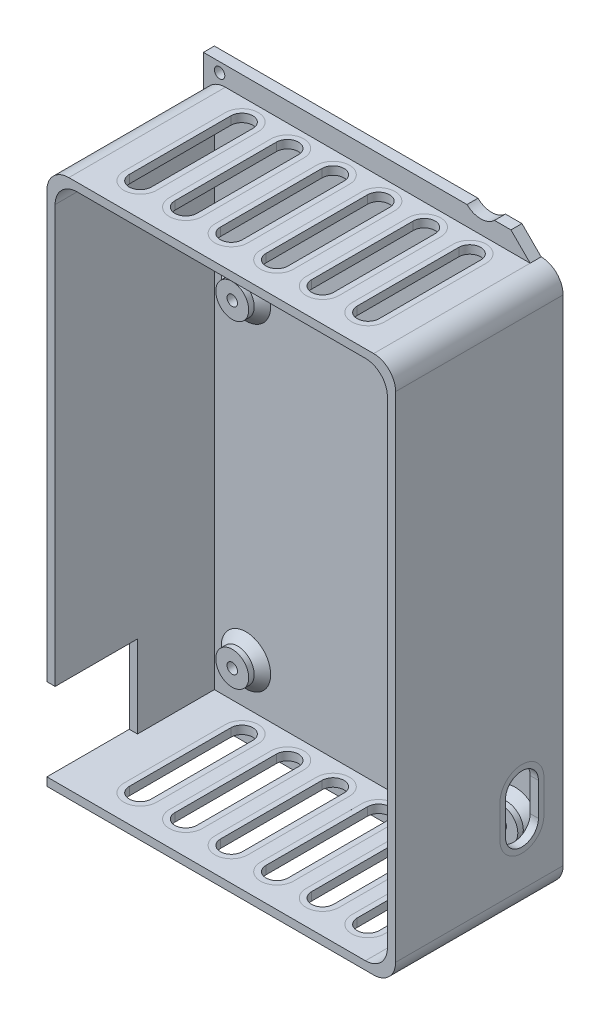
from build123d import *

# Parameters (mm, degrees)
SKETCH1_W            = 98
SKETCH1_H            = 63.5
SKETCH1_R            = 0.95
BOSS_EXTRUDE1_DEPTH  = 1.5
BOSS_EXTRUDE7_START  = 1.5
SKETCH1_9_R          = 3
SKETCH1_9_R_2        = 0.95
BOSS_EXTRUDE7_DEPTH  = 2.5
SKETCH1_15_R         = 2.1
SKETCH1_15_R_2       = 0.95
CUT_EXTRUDE3_DEPTH   = 2.2
CHAMFER1_SIZE        = 1.5
BOSS_EXTRUDE6_START  = 1.5
SKETCH1_8_W          = 98
SKETCH1_8_H          = 63.5
SKETCH1_8_W_2        = 95
SKETCH1_8_H_2        = 60.5
BOSS_EXTRUDE6_DEPTH  = 29
SKETCH3_W            = 15
SKETCH3_H            = 15
CUT_EXTRUDE2_DEPTH   = 1.5
FILLET1_R            = 4
BOSS_EXTRUDE11_START = -2
SKETCH6_R            = 0.95
BOSS_EXTRUDE11_DEPTH = 2
CUT_EXTRUDE4_DEPTH   = 1.5
BOSS_EXTRUDE10_DEPTH = 1.5
CUT_EXTRUDE7_DEPTH   = 1.5
CUT_EXTRUDE8_START   = -96.5
CUT_EXTRUDE8_DEPTH   = 1.5
BOSS_EXTRUDE8_DEPTH  = 1.5
BOSS_EXTRUDE9_START  = -96.5
BOSS_EXTRUDE9_DEPTH  = 1.5
LPATTERN1_START      = -49
LPATTERN1_DEPTH      = 1.5
LPATTERN1_2_DEPTH    = 1.5
LPATTERN1_3_DEPTH    = 1.5
LPATTERN1_4_DEPTH    = 1.5
LPATTERN1_5_DEPTH    = 1.5
LPATTERN1_START_2    = 47.5
LPATTERN1_6_DEPTH    = 1.5
LPATTERN1_7_DEPTH    = 1.5
LPATTERN1_8_DEPTH    = 1.5
LPATTERN1_9_DEPTH    = 1.5
LPATTERN1_10_DEPTH   = 1.5


with BuildPart() as part:
    # Sketch1 → Boss-Extrude1 (new body)
    with BuildSketch(Plane(origin=(0, 0, 0), x_dir=(0, 1, 0), z_dir=(0, 0, 1))):
        Rectangle(SKETCH1_W, SKETCH1_H)
        with Locations(Location((-40, 24.5, 0), (0, 0, 270))):
            Circle(SKETCH1_R, mode=Mode.SUBTRACT)
        with Locations(Location((-40, -24.5, 0), (0, 0, 270))):
            Circle(SKETCH1_R, mode=Mode.SUBTRACT)
        with Locations(Location((18, 24.5, 0), (0, 0, 270))):
            Circle(SKETCH1_R, mode=Mode.SUBTRACT)
        with Locations(Location((18, -24.5, 0), (0, 0, 270))):
            Circle(SKETCH1_R, mode=Mode.SUBTRACT)
    extrude(amount=BOSS_EXTRUDE1_DEPTH)

    # Sketch1<9> → Boss-Extrude7 (add)
    # profile 1 of 4: a face of its own
    with BuildSketch(Plane(origin=(0, 0, 0), x_dir=(0, 1, 0), z_dir=(0, 0, 1)).offset(BOSS_EXTRUDE7_START)):
        with Locations(Location((-40, 24.5, 0), (0, 0, 270))):
            Circle(SKETCH1_9_R)
        with Locations(Location((-40, 24.5, 0), (0, 0, 270))):
            Circle(SKETCH1_9_R_2, mode=Mode.SUBTRACT)
    # profile 2 of 4: a face of its own
    with BuildSketch(Plane(origin=(0, 0, 0), x_dir=(0, 1, 0), z_dir=(0, 0, 1)).offset(BOSS_EXTRUDE7_START)):
        with Locations(Location((-40, -24.5, 0), (0, 0, 270))):
            Circle(SKETCH1_9_R)
        with Locations(Location((-40, -24.5, 0), (0, 0, 270))):
            Circle(SKETCH1_9_R_2, mode=Mode.SUBTRACT)
    # profile 3 of 4: a face of its own
    with BuildSketch(Plane(origin=(0, 0, 0), x_dir=(0, 1, 0), z_dir=(0, 0, 1)).offset(BOSS_EXTRUDE7_START)):
        with Locations(Location((18, 24.5, 0), (0, 0, 270))):
            Circle(SKETCH1_9_R)
        with Locations(Location((18, 24.5, 0), (0, 0, 270))):
            Circle(SKETCH1_9_R_2, mode=Mode.SUBTRACT)
    # profile 4 of 4: a face of its own
    with BuildSketch(Plane(origin=(0, 0, 0), x_dir=(0, 1, 0), z_dir=(0, 0, 1)).offset(BOSS_EXTRUDE7_START)):
        with Locations(Location((18, -24.5, 0), (0, 0, 270))):
            Circle(SKETCH1_9_R)
        with Locations(Location((18, -24.5, 0), (0, 0, 270))):
            Circle(SKETCH1_9_R_2, mode=Mode.SUBTRACT)
    extrude(amount=BOSS_EXTRUDE7_DEPTH)

    # Sketch1<15> → Cut-Extrude3 (cut)
    # profile 1 of 4: a face of its own
    with BuildSketch(Plane(origin=(0, 0, 0), x_dir=(0, 1, 0), z_dir=(0, 0, 1))):
        with Locations(Location((18, -24.5, 0), (0, 0, 270))):
            Circle(SKETCH1_15_R)
        with Locations(Location((18, -24.5, 0), (0, 0, 270))):
            Circle(SKETCH1_15_R_2, mode=Mode.SUBTRACT)
    # profile 2 of 4: a face of its own
    with BuildSketch(Plane(origin=(0, 0, 0), x_dir=(0, 1, 0), z_dir=(0, 0, 1))):
        with Locations(Location((18, 24.5, 0), (0, 0, 270))):
            Circle(SKETCH1_15_R)
        with Locations(Location((18, 24.5, 0), (0, 0, 270))):
            Circle(SKETCH1_15_R_2, mode=Mode.SUBTRACT)
    # profile 3 of 4: a face of its own
    with BuildSketch(Plane(origin=(0, 0, 0), x_dir=(0, 1, 0), z_dir=(0, 0, 1))):
        with Locations(Location((-40, 24.5, 0), (0, 0, 270))):
            Circle(SKETCH1_15_R)
        with Locations(Location((-40, 24.5, 0), (0, 0, 270))):
            Circle(SKETCH1_15_R_2, mode=Mode.SUBTRACT)
    # profile 4 of 4: a face of its own
    with BuildSketch(Plane(origin=(0, 0, 0), x_dir=(0, 1, 0), z_dir=(0, 0, 1))):
        with Locations(Location((-40, -24.5, 0), (0, 0, 270))):
            Circle(SKETCH1_15_R)
        with Locations(Location((-40, -24.5, 0), (0, 0, 270))):
            Circle(SKETCH1_15_R_2, mode=Mode.SUBTRACT)
    extrude(amount=CUT_EXTRUDE3_DEPTH, mode=Mode.SUBTRACT)

    # Chamfer1
    chamfer1_edges = [part.edges().sort_by_distance(p)[0] for p in [
        (21.5, 18, 1.5),
        (-27.5, 18, 1.5),
        (-27.5, -40, 1.5),
        (21.5, -40, 1.5),
    ]]
    chamfer(chamfer1_edges, length=CHAMFER1_SIZE)

    # Sketch1<8> → Boss-Extrude6 (add)
    with BuildSketch(Plane(origin=(0, 0, 0), x_dir=(0, 1, 0), z_dir=(0, 0, 1)).offset(BOSS_EXTRUDE6_START)):
        Rectangle(SKETCH1_8_W, SKETCH1_8_H)
        Rectangle(SKETCH1_8_W_2, SKETCH1_8_H_2, mode=Mode.SUBTRACT)
    extrude(amount=BOSS_EXTRUDE6_DEPTH)

    # Sketch3 → Cut-Extrude2 (cut)
    with BuildSketch(Plane.YZ.offset(-30.25)):
        with Locations((-40, 23)):
            Rectangle(SKETCH3_W, SKETCH3_H)
    extrude(amount=-CUT_EXTRUDE2_DEPTH, mode=Mode.SUBTRACT)

    # Fillet1
    fillet1_edges = [part.edges().sort_by_distance(p)[0] for p in [
        (-30.25, 47.5, 16),
        (30.25, -47.5, 16),
        (30.25, 47.5, 16),
        (31.75, -49, 15.25),
        (-31.75, 49, 15.25),
        (31.75, 49, 15.25),
    ]]
    fillet(fillet1_edges, radius=FILLET1_R)

    # Sketch6 → Boss-Extrude11 (add)
    # profile 1 of 2: a face of its own
    with BuildSketch(Plane(origin=(0, 0, 0), x_dir=(1, 0, 0), z_dir=(0, 0, -1)).offset(BOSS_EXTRUDE11_START)):
        with BuildLine():
            Line((-31.75, 49), (27.75, 49))
            Line((27.75, 49), (24.25, 52.5))
            Line((24.25, 52.5), (21.25, 52.5))
            ThreePointArc((21.25, 52.5), (18.75, 51.5), (16.25, 52.5))
            Line((16.25, 52.5), (-31.75, 52.5))
            Line((-31.75, 52.5), (-31.75, 49))
        make_face()
        with Locations(Location((-28.8, 50.75, 0), (0, 0, 180))):
            Circle(SKETCH6_R, mode=Mode.SUBTRACT)
    # profile 2 of 2: a face of its own
    with BuildSketch(Plane(origin=(0, 0, 0), x_dir=(1, 0, 0), z_dir=(0, 0, -1)).offset(BOSS_EXTRUDE11_START)):
        with BuildLine():
            Line((-31.75, -45), (-31.75, -52.5))
            Line((-31.75, -52.5), (16.25, -52.5))
            ThreePointArc((16.25, -52.5), (18.75, -51.5), (21.25, -52.5))
            Line((21.25, -52.5), (24.25, -52.5))
            Line((24.25, -52.5), (27.75, -49))
            Line((27.75, -49), (-27.75, -49))
            ThreePointArc((-27.75, -49), (-30.578427125, -47.828427125), (-31.75, -45))
        make_face()
        with Locations(Location((-28.8, -50.75, 0), (0, 0, 180))):
            Circle(SKETCH6_R, mode=Mode.SUBTRACT)
    extrude(amount=BOSS_EXTRUDE11_DEPTH)

    # Sketch4 → Cut-Extrude4 (cut)
    # profile 1 of 2: a face of its own
    with BuildSketch(Plane(origin=(30.25, 0, 0), x_dir=(0, -1, 0), z_dir=(-1, 0, 0))):
        with BuildLine():
            Line((29.3, 3.5), (35.3, 3.5))
            ThreePointArc((35.3, 3.5), (39.3, 7.5), (35.3, 11.5))
            Line((35.3, 11.5), (29.3, 11.5))
            ThreePointArc((29.3, 11.5), (25.3, 7.5), (29.3, 3.5))
        make_face()
        with BuildLine():
            ThreePointArc((35.3, 4.5), (38.3, 7.5), (35.3, 10.5))
            Line((35.3, 10.5), (29.3, 10.5))
            ThreePointArc((29.3, 10.5), (26.3, 7.5), (29.3, 4.5))
            Line((29.3, 4.5), (35.3, 4.5))
        make_face(mode=Mode.SUBTRACT)
    # profile 2 of 2: a face of its own
    with BuildSketch(Plane(origin=(30.25, 0, 0), x_dir=(0, -1, 0), z_dir=(-1, 0, 0))):
        with BuildLine():
            Line((29.3, 4.5), (35.3, 4.5))
            ThreePointArc((35.3, 4.5), (38.3, 7.5), (35.3, 10.5))
            Line((35.3, 10.5), (29.3, 10.5))
            ThreePointArc((29.3, 10.5), (26.3, 7.5), (29.3, 4.5))
        make_face()
    extrude(amount=-CUT_EXTRUDE4_DEPTH, mode=Mode.SUBTRACT)

    # Sketch5 → Cut-Extrude7 (cut)
    with BuildSketch(Plane(origin=(0, 49, 0), x_dir=(-1, 0, 0), z_dir=(0, 1, 0))):
        with BuildLine():
            Line((-17.75, 24.5), (-17.75, 6))
            ThreePointArc((-17.75, 6), (-20.75, 3), (-23.75, 6))
            Line((-23.75, 6), (-23.75, 24.5))
            ThreePointArc((-23.75, 24.5), (-20.75, 27.5), (-17.75, 24.5))
        make_face()
    extrude(amount=-CUT_EXTRUDE7_DEPTH, mode=Mode.SUBTRACT)

    # Sketch5<6> → Cut-Extrude8 (cut)
    with BuildSketch(Plane(origin=(0, 49, 0), x_dir=(-1, 0, 0), z_dir=(0, 1, 0)).offset(CUT_EXTRUDE8_START)):
        with BuildLine():
            Line((-17.75, 24.5), (-17.75, 6))
            ThreePointArc((-17.75, 6), (-20.75, 3), (-23.75, 6))
            Line((-23.75, 6), (-23.75, 24.5))
            ThreePointArc((-23.75, 24.5), (-20.75, 27.5), (-17.75, 24.5))
        make_face()
    extrude(amount=-CUT_EXTRUDE8_DEPTH, mode=Mode.SUBTRACT)

    # LPattern1 11: loft between two sections, ruled curve by curve
    lpattern1_11_from = [
        Edge.make_three_point_arc((-17.75, 47.5, 6), (-18.628679656, 47.5, 3.878679656), (-20.75, 47.5, 3)),
        Edge.make_three_point_arc((-20.75, 47.5, 3), (-22.871320344, 47.5, 3.878679656), (-23.75, 47.5, 6)),
        Edge.make_three_point_arc((-23.75, 47.5, 24.5), (-22.871320344, 47.5, 26.621320344), (-20.75, 47.5, 27.5)),
        Edge.make_three_point_arc((-20.75, 47.5, 27.5), (-18.628679656, 47.5, 26.621320344), (-17.75, 47.5, 24.5)),
        Edge.make_line((-23.75, 47.5, 6), (-23.75, 47.5, 24.5)),
        Edge.make_line((-17.75, 47.5, 6), (-17.75, 47.5, 24.5)),
    ]
    lpattern1_11_to = [
        Edge.make_three_point_arc((-17.75, 49, 6), (-18.628679656, 49, 3.878679656), (-20.75, 49, 3)),
        Edge.make_three_point_arc((-20.75, 49, 3), (-22.871320344, 49, 3.878679656), (-23.75, 49, 6)),
        Edge.make_three_point_arc((-23.75, 49, 24.5), (-22.871320344, 49, 26.621320344), (-20.75, 49, 27.5)),
        Edge.make_three_point_arc((-20.75, 49, 27.5), (-18.628679656, 49, 26.621320344), (-17.75, 49, 24.5)),
        Edge.make_line((-23.75, 49, 6), (-23.75, 49, 24.5)),
        Edge.make_line((-17.75, 49, 6), (-17.75, 49, 24.5)),
    ]
    lpattern1_11 = Solid(Shell([*[Face.make_surface_from_curves(lpattern1_11_from[k], lpattern1_11_to[k]) for k in range(6)], Face(Wire(lpattern1_11_from)), Face(Wire(lpattern1_11_to))]))
    add(lpattern1_11, mode=Mode.SUBTRACT)

    # LPattern1 12: loft between two sections, ruled curve by curve
    lpattern1_12_from = [
        Edge.make_three_point_arc((-17.75, -49, 6), (-18.628679656, -49, 3.878679656), (-20.75, -49, 3)),
        Edge.make_three_point_arc((-20.75, -49, 3), (-22.871320344, -49, 3.878679656), (-23.75, -49, 6)),
        Edge.make_three_point_arc((-23.75, -49, 24.5), (-22.871320344, -49, 26.621320344), (-20.75, -49, 27.5)),
        Edge.make_three_point_arc((-20.75, -49, 27.5), (-18.628679656, -49, 26.621320344), (-17.75, -49, 24.5)),
        Edge.make_line((-23.75, -49, 24.5), (-23.75, -49, 6)),
        Edge.make_line((-17.75, -49, 24.5), (-17.75, -49, 6)),
    ]
    lpattern1_12_to = [
        Edge.make_three_point_arc((-17.75, -47.5, 6), (-18.628679656, -47.5, 3.878679656), (-20.75, -47.5, 3)),
        Edge.make_three_point_arc((-20.75, -47.5, 3), (-22.871320344, -47.5, 3.878679656), (-23.75, -47.5, 6)),
        Edge.make_three_point_arc((-23.75, -47.5, 24.5), (-22.871320344, -47.5, 26.621320344), (-20.75, -47.5, 27.5)),
        Edge.make_three_point_arc((-20.75, -47.5, 27.5), (-18.628679656, -47.5, 26.621320344), (-17.75, -47.5, 24.5)),
        Edge.make_line((-23.75, -47.5, 24.5), (-23.75, -47.5, 6)),
        Edge.make_line((-17.75, -47.5, 24.5), (-17.75, -47.5, 6)),
    ]
    lpattern1_12 = Solid(Shell([*[Face.make_surface_from_curves(lpattern1_12_from[k], lpattern1_12_to[k]) for k in range(6)], Face(Wire(lpattern1_12_from)), Face(Wire(lpattern1_12_to))]))
    add(lpattern1_12, mode=Mode.SUBTRACT)

    # LPattern1 13: loft between two sections, ruled curve by curve
    lpattern1_13_from = [
        Edge.make_three_point_arc((-9.45, 47.5, 6), (-10.328679656, 47.5, 3.878679656), (-12.45, 47.5, 3)),
        Edge.make_three_point_arc((-12.45, 47.5, 3), (-14.571320344, 47.5, 3.878679656), (-15.45, 47.5, 6)),
        Edge.make_three_point_arc((-15.45, 47.5, 24.5), (-14.571320344, 47.5, 26.621320344), (-12.45, 47.5, 27.5)),
        Edge.make_three_point_arc((-12.45, 47.5, 27.5), (-10.328679656, 47.5, 26.621320344), (-9.45, 47.5, 24.5)),
        Edge.make_line((-15.45, 47.5, 6), (-15.45, 47.5, 24.5)),
        Edge.make_line((-9.45, 47.5, 6), (-9.45, 47.5, 24.5)),
    ]
    lpattern1_13_to = [
        Edge.make_three_point_arc((-9.45, 49, 6), (-10.328679656, 49, 3.878679656), (-12.45, 49, 3)),
        Edge.make_three_point_arc((-12.45, 49, 3), (-14.571320344, 49, 3.878679656), (-15.45, 49, 6)),
        Edge.make_three_point_arc((-15.45, 49, 24.5), (-14.571320344, 49, 26.621320344), (-12.45, 49, 27.5)),
        Edge.make_three_point_arc((-12.45, 49, 27.5), (-10.328679656, 49, 26.621320344), (-9.45, 49, 24.5)),
        Edge.make_line((-15.45, 49, 6), (-15.45, 49, 24.5)),
        Edge.make_line((-9.45, 49, 6), (-9.45, 49, 24.5)),
    ]
    lpattern1_13 = Solid(Shell([*[Face.make_surface_from_curves(lpattern1_13_from[k], lpattern1_13_to[k]) for k in range(6)], Face(Wire(lpattern1_13_from)), Face(Wire(lpattern1_13_to))]))
    add(lpattern1_13, mode=Mode.SUBTRACT)

    # LPattern1 14: loft between two sections, ruled curve by curve
    lpattern1_14_from = [
        Edge.make_three_point_arc((-9.45, -49, 6), (-10.328679656, -49, 3.878679656), (-12.45, -49, 3)),
        Edge.make_three_point_arc((-12.45, -49, 3), (-14.571320344, -49, 3.878679656), (-15.45, -49, 6)),
        Edge.make_three_point_arc((-15.45, -49, 24.5), (-14.571320344, -49, 26.621320344), (-12.45, -49, 27.5)),
        Edge.make_three_point_arc((-12.45, -49, 27.5), (-10.328679656, -49, 26.621320344), (-9.45, -49, 24.5)),
        Edge.make_line((-15.45, -49, 24.5), (-15.45, -49, 6)),
        Edge.make_line((-9.45, -49, 24.5), (-9.45, -49, 6)),
    ]
    lpattern1_14_to = [
        Edge.make_three_point_arc((-9.45, -47.5, 6), (-10.328679656, -47.5, 3.878679656), (-12.45, -47.5, 3)),
        Edge.make_three_point_arc((-12.45, -47.5, 3), (-14.571320344, -47.5, 3.878679656), (-15.45, -47.5, 6)),
        Edge.make_three_point_arc((-15.45, -47.5, 24.5), (-14.571320344, -47.5, 26.621320344), (-12.45, -47.5, 27.5)),
        Edge.make_three_point_arc((-12.45, -47.5, 27.5), (-10.328679656, -47.5, 26.621320344), (-9.45, -47.5, 24.5)),
        Edge.make_line((-15.45, -47.5, 24.5), (-15.45, -47.5, 6)),
        Edge.make_line((-9.45, -47.5, 24.5), (-9.45, -47.5, 6)),
    ]
    lpattern1_14 = Solid(Shell([*[Face.make_surface_from_curves(lpattern1_14_from[k], lpattern1_14_to[k]) for k in range(6)], Face(Wire(lpattern1_14_from)), Face(Wire(lpattern1_14_to))]))
    add(lpattern1_14, mode=Mode.SUBTRACT)

    # LPattern1 15: loft between two sections, ruled curve by curve
    lpattern1_15_from = [
        Edge.make_three_point_arc((-1.15, 47.5, 6), (-2.028679656, 47.5, 3.878679656), (-4.15, 47.5, 3)),
        Edge.make_three_point_arc((-4.15, 47.5, 3), (-6.271320344, 47.5, 3.878679656), (-7.15, 47.5, 6)),
        Edge.make_three_point_arc((-7.15, 47.5, 24.5), (-6.271320344, 47.5, 26.621320344), (-4.15, 47.5, 27.5)),
        Edge.make_three_point_arc((-4.15, 47.5, 27.5), (-2.028679656, 47.5, 26.621320344), (-1.15, 47.5, 24.5)),
        Edge.make_line((-7.15, 47.5, 6), (-7.15, 47.5, 24.5)),
        Edge.make_line((-1.15, 47.5, 6), (-1.15, 47.5, 24.5)),
    ]
    lpattern1_15_to = [
        Edge.make_three_point_arc((-1.15, 49, 6), (-2.028679656, 49, 3.878679656), (-4.15, 49, 3)),
        Edge.make_three_point_arc((-4.15, 49, 3), (-6.271320344, 49, 3.878679656), (-7.15, 49, 6)),
        Edge.make_three_point_arc((-7.15, 49, 24.5), (-6.271320344, 49, 26.621320344), (-4.15, 49, 27.5)),
        Edge.make_three_point_arc((-4.15, 49, 27.5), (-2.028679656, 49, 26.621320344), (-1.15, 49, 24.5)),
        Edge.make_line((-7.15, 49, 6), (-7.15, 49, 24.5)),
        Edge.make_line((-1.15, 49, 6), (-1.15, 49, 24.5)),
    ]
    lpattern1_15 = Solid(Shell([*[Face.make_surface_from_curves(lpattern1_15_from[k], lpattern1_15_to[k]) for k in range(6)], Face(Wire(lpattern1_15_from)), Face(Wire(lpattern1_15_to))]))
    add(lpattern1_15, mode=Mode.SUBTRACT)

    # LPattern1 16: loft between two sections, ruled curve by curve
    lpattern1_16_from = [
        Edge.make_three_point_arc((-1.15, -49, 6), (-2.028679656, -49, 3.878679656), (-4.15, -49, 3)),
        Edge.make_three_point_arc((-4.15, -49, 3), (-6.271320344, -49, 3.878679656), (-7.15, -49, 6)),
        Edge.make_three_point_arc((-7.15, -49, 24.5), (-6.271320344, -49, 26.621320344), (-4.15, -49, 27.5)),
        Edge.make_three_point_arc((-4.15, -49, 27.5), (-2.028679656, -49, 26.621320344), (-1.15, -49, 24.5)),
        Edge.make_line((-7.15, -49, 24.5), (-7.15, -49, 6)),
        Edge.make_line((-1.15, -49, 24.5), (-1.15, -49, 6)),
    ]
    lpattern1_16_to = [
        Edge.make_three_point_arc((-1.15, -47.5, 6), (-2.028679656, -47.5, 3.878679656), (-4.15, -47.5, 3)),
        Edge.make_three_point_arc((-4.15, -47.5, 3), (-6.271320344, -47.5, 3.878679656), (-7.15, -47.5, 6)),
        Edge.make_three_point_arc((-7.15, -47.5, 24.5), (-6.271320344, -47.5, 26.621320344), (-4.15, -47.5, 27.5)),
        Edge.make_three_point_arc((-4.15, -47.5, 27.5), (-2.028679656, -47.5, 26.621320344), (-1.15, -47.5, 24.5)),
        Edge.make_line((-7.15, -47.5, 24.5), (-7.15, -47.5, 6)),
        Edge.make_line((-1.15, -47.5, 24.5), (-1.15, -47.5, 6)),
    ]
    lpattern1_16 = Solid(Shell([*[Face.make_surface_from_curves(lpattern1_16_from[k], lpattern1_16_to[k]) for k in range(6)], Face(Wire(lpattern1_16_from)), Face(Wire(lpattern1_16_to))]))
    add(lpattern1_16, mode=Mode.SUBTRACT)

    # LPattern1 17: loft between two sections, ruled curve by curve
    lpattern1_17_from = [
        Edge.make_three_point_arc((7.15, 47.5, 6), (6.271320344, 47.5, 3.878679656), (4.15, 47.5, 3)),
        Edge.make_three_point_arc((4.15, 47.5, 3), (2.028679656, 47.5, 3.878679656), (1.15, 47.5, 6)),
        Edge.make_three_point_arc((1.15, 47.5, 24.5), (2.028679656, 47.5, 26.621320344), (4.15, 47.5, 27.5)),
        Edge.make_three_point_arc((4.15, 47.5, 27.5), (6.271320344, 47.5, 26.621320344), (7.15, 47.5, 24.5)),
        Edge.make_line((1.15, 47.5, 6), (1.15, 47.5, 24.5)),
        Edge.make_line((7.15, 47.5, 6), (7.15, 47.5, 24.5)),
    ]
    lpattern1_17_to = [
        Edge.make_three_point_arc((7.15, 49, 6), (6.271320344, 49, 3.878679656), (4.15, 49, 3)),
        Edge.make_three_point_arc((4.15, 49, 3), (2.028679656, 49, 3.878679656), (1.15, 49, 6)),
        Edge.make_three_point_arc((1.15, 49, 24.5), (2.028679656, 49, 26.621320344), (4.15, 49, 27.5)),
        Edge.make_three_point_arc((4.15, 49, 27.5), (6.271320344, 49, 26.621320344), (7.15, 49, 24.5)),
        Edge.make_line((1.15, 49, 6), (1.15, 49, 24.5)),
        Edge.make_line((7.15, 49, 6), (7.15, 49, 24.5)),
    ]
    lpattern1_17 = Solid(Shell([*[Face.make_surface_from_curves(lpattern1_17_from[k], lpattern1_17_to[k]) for k in range(6)], Face(Wire(lpattern1_17_from)), Face(Wire(lpattern1_17_to))]))
    add(lpattern1_17, mode=Mode.SUBTRACT)

    # LPattern1 18: loft between two sections, ruled curve by curve
    lpattern1_18_from = [
        Edge.make_three_point_arc((7.15, -49, 6), (6.271320344, -49, 3.878679656), (4.15, -49, 3)),
        Edge.make_three_point_arc((4.15, -49, 3), (2.028679656, -49, 3.878679656), (1.15, -49, 6)),
        Edge.make_three_point_arc((1.15, -49, 24.5), (2.028679656, -49, 26.621320344), (4.15, -49, 27.5)),
        Edge.make_three_point_arc((4.15, -49, 27.5), (6.271320344, -49, 26.621320344), (7.15, -49, 24.5)),
        Edge.make_line((1.15, -49, 24.5), (1.15, -49, 6)),
        Edge.make_line((7.15, -49, 24.5), (7.15, -49, 6)),
    ]
    lpattern1_18_to = [
        Edge.make_three_point_arc((7.15, -47.5, 6), (6.271320344, -47.5, 3.878679656), (4.15, -47.5, 3)),
        Edge.make_three_point_arc((4.15, -47.5, 3), (2.028679656, -47.5, 3.878679656), (1.15, -47.5, 6)),
        Edge.make_three_point_arc((1.15, -47.5, 24.5), (2.028679656, -47.5, 26.621320344), (4.15, -47.5, 27.5)),
        Edge.make_three_point_arc((4.15, -47.5, 27.5), (6.271320344, -47.5, 26.621320344), (7.15, -47.5, 24.5)),
        Edge.make_line((1.15, -47.5, 24.5), (1.15, -47.5, 6)),
        Edge.make_line((7.15, -47.5, 24.5), (7.15, -47.5, 6)),
    ]
    lpattern1_18 = Solid(Shell([*[Face.make_surface_from_curves(lpattern1_18_from[k], lpattern1_18_to[k]) for k in range(6)], Face(Wire(lpattern1_18_from)), Face(Wire(lpattern1_18_to))]))
    add(lpattern1_18, mode=Mode.SUBTRACT)

    # LPattern1 19: loft between two sections, ruled curve by curve
    lpattern1_19_from = [
        Edge.make_three_point_arc((15.45, 47.5, 6), (14.571320344, 47.5, 3.878679656), (12.45, 47.5, 3)),
        Edge.make_three_point_arc((12.45, 47.5, 3), (10.328679656, 47.5, 3.878679656), (9.45, 47.5, 6)),
        Edge.make_three_point_arc((9.45, 47.5, 24.5), (10.328679656, 47.5, 26.621320344), (12.45, 47.5, 27.5)),
        Edge.make_three_point_arc((12.45, 47.5, 27.5), (14.571320344, 47.5, 26.621320344), (15.45, 47.5, 24.5)),
        Edge.make_line((9.45, 47.5, 6), (9.45, 47.5, 24.5)),
        Edge.make_line((15.45, 47.5, 6), (15.45, 47.5, 24.5)),
    ]
    lpattern1_19_to = [
        Edge.make_three_point_arc((15.45, 49, 6), (14.571320344, 49, 3.878679656), (12.45, 49, 3)),
        Edge.make_three_point_arc((12.45, 49, 3), (10.328679656, 49, 3.878679656), (9.45, 49, 6)),
        Edge.make_three_point_arc((9.45, 49, 24.5), (10.328679656, 49, 26.621320344), (12.45, 49, 27.5)),
        Edge.make_three_point_arc((12.45, 49, 27.5), (14.571320344, 49, 26.621320344), (15.45, 49, 24.5)),
        Edge.make_line((9.45, 49, 6), (9.45, 49, 24.5)),
        Edge.make_line((15.45, 49, 6), (15.45, 49, 24.5)),
    ]
    lpattern1_19 = Solid(Shell([*[Face.make_surface_from_curves(lpattern1_19_from[k], lpattern1_19_to[k]) for k in range(6)], Face(Wire(lpattern1_19_from)), Face(Wire(lpattern1_19_to))]))
    add(lpattern1_19, mode=Mode.SUBTRACT)

    # LPattern1 20: loft between two sections, ruled curve by curve
    lpattern1_20_from = [
        Edge.make_three_point_arc((15.45, -49, 6), (14.571320344, -49, 3.878679656), (12.45, -49, 3)),
        Edge.make_three_point_arc((12.45, -49, 3), (10.328679656, -49, 3.878679656), (9.45, -49, 6)),
        Edge.make_three_point_arc((9.45, -49, 24.5), (10.328679656, -49, 26.621320344), (12.45, -49, 27.5)),
        Edge.make_three_point_arc((12.45, -49, 27.5), (14.571320344, -49, 26.621320344), (15.45, -49, 24.5)),
        Edge.make_line((9.45, -49, 24.5), (9.45, -49, 6)),
        Edge.make_line((15.45, -49, 24.5), (15.45, -49, 6)),
    ]
    lpattern1_20_to = [
        Edge.make_three_point_arc((15.45, -47.5, 6), (14.571320344, -47.5, 3.878679656), (12.45, -47.5, 3)),
        Edge.make_three_point_arc((12.45, -47.5, 3), (10.328679656, -47.5, 3.878679656), (9.45, -47.5, 6)),
        Edge.make_three_point_arc((9.45, -47.5, 24.5), (10.328679656, -47.5, 26.621320344), (12.45, -47.5, 27.5)),
        Edge.make_three_point_arc((12.45, -47.5, 27.5), (14.571320344, -47.5, 26.621320344), (15.45, -47.5, 24.5)),
        Edge.make_line((9.45, -47.5, 24.5), (9.45, -47.5, 6)),
        Edge.make_line((15.45, -47.5, 24.5), (15.45, -47.5, 6)),
    ]
    lpattern1_20 = Solid(Shell([*[Face.make_surface_from_curves(lpattern1_20_from[k], lpattern1_20_to[k]) for k in range(6)], Face(Wire(lpattern1_20_from)), Face(Wire(lpattern1_20_to))]))
    add(lpattern1_20, mode=Mode.SUBTRACT)


with BuildPart() as body_2:
    # Sketch4<3> → Boss-Extrude10 (new body)
    with BuildSketch(Plane(origin=(30.25, 0, 0), x_dir=(0, -1, 0), z_dir=(-1, 0, 0))):
        with BuildLine():
            Line((29.3, 3.5), (35.3, 3.5))
            ThreePointArc((35.3, 3.5), (39.3, 7.5), (35.3, 11.5))
            Line((35.3, 11.5), (29.3, 11.5))
            ThreePointArc((29.3, 11.5), (25.3, 7.5), (29.3, 3.5))
        make_face()
        with BuildLine():
            ThreePointArc((35.3, 4.5), (38.3, 7.5), (35.3, 10.5))
            Line((35.3, 10.5), (29.3, 10.5))
            ThreePointArc((29.3, 10.5), (26.3, 7.5), (29.3, 4.5))
            Line((29.3, 4.5), (35.3, 4.5))
        make_face(mode=Mode.SUBTRACT)
    extrude(amount=-BOSS_EXTRUDE10_DEPTH)


with BuildPart() as body_3:
    # Sketch5<5> → Boss-Extrude8 (new body)
    with BuildSketch(Plane(origin=(0, 49, 0), x_dir=(-1, 0, 0), z_dir=(0, 1, 0))):
        with BuildLine():
            Line((-17.75, 24.5), (-17.75, 6))
            ThreePointArc((-17.75, 6), (-20.75, 3), (-23.75, 6))
            Line((-23.75, 6), (-23.75, 24.5))
            ThreePointArc((-23.75, 24.5), (-20.75, 27.5), (-17.75, 24.5))
        make_face()
        with BuildLine():
            Line((-18.75, 24.5), (-18.75, 6))
            ThreePointArc((-18.75, 6), (-20.75, 4), (-22.75, 6))
            Line((-22.75, 6), (-22.75, 24.5))
            ThreePointArc((-22.75, 24.5), (-20.75, 26.5), (-18.75, 24.5))
        make_face(mode=Mode.SUBTRACT)
    extrude(amount=-BOSS_EXTRUDE8_DEPTH)


with BuildPart() as body_4:
    # Sketch5<8> → Boss-Extrude9 (new body)
    with BuildSketch(Plane(origin=(0, 49, 0), x_dir=(-1, 0, 0), z_dir=(0, 1, 0)).offset(BOSS_EXTRUDE9_START)):
        with BuildLine():
            Line((-17.75, 24.5), (-17.75, 6))
            ThreePointArc((-17.75, 6), (-20.75, 3), (-23.75, 6))
            Line((-23.75, 6), (-23.75, 24.5))
            ThreePointArc((-23.75, 24.5), (-20.75, 27.5), (-17.75, 24.5))
        make_face()
        with BuildLine():
            Line((-18.75, 24.5), (-18.75, 6))
            ThreePointArc((-18.75, 6), (-20.75, 4), (-22.75, 6))
            Line((-22.75, 6), (-22.75, 24.5))
            ThreePointArc((-22.75, 24.5), (-20.75, 26.5), (-18.75, 24.5))
        make_face(mode=Mode.SUBTRACT)
    extrude(amount=-BOSS_EXTRUDE9_DEPTH)


with BuildPart() as body_5:
    # LPattern1: read off the stored shape, not the designer's step
    # LPattern1 outline → LPattern1 (new body)
    with BuildSketch(Plane(origin=(0, 0, 0), x_dir=(1, 0, 0), z_dir=(0, 1, 0)).offset(LPATTERN1_START)):
        with BuildLine():
            Line((-23.75, -6), (-23.75, -24.5))
            ThreePointArc((-23.75, -24.5), (-20.75, -27.5), (-17.75, -24.5))
            Line((-17.75, -24.5), (-17.75, -6))
            ThreePointArc((-17.75, -6), (-20.75, -3), (-23.75, -6))
        make_face()
        with BuildLine():
            ThreePointArc((-18.75, -24.5), (-20.75, -26.5), (-22.75, -24.5))
            Line((-22.75, -24.5), (-22.75, -6))
            ThreePointArc((-22.75, -6), (-20.75, -4), (-18.75, -6))
            Line((-18.75, -6), (-18.75, -24.5))
        make_face(mode=Mode.SUBTRACT)
    extrude(amount=LPATTERN1_DEPTH)


with BuildPart() as body_6:
    # LPattern1 2 outline → LPattern1 2 (new body)
    with BuildSketch(Plane(origin=(0, 0, 0), x_dir=(1, 0, 0), z_dir=(0, 1, 0)).offset(LPATTERN1_START)):
        with BuildLine():
            Line((-15.45, -6), (-15.45, -24.5))
            ThreePointArc((-15.45, -24.5), (-12.45, -27.5), (-9.45, -24.5))
            Line((-9.45, -24.5), (-9.45, -6))
            ThreePointArc((-9.45, -6), (-12.45, -3), (-15.45, -6))
        make_face()
        with BuildLine():
            ThreePointArc((-10.45, -24.5), (-12.45, -26.5), (-14.45, -24.5))
            Line((-14.45, -24.5), (-14.45, -6))
            ThreePointArc((-14.45, -6), (-12.45, -4), (-10.45, -6))
            Line((-10.45, -6), (-10.45, -24.5))
        make_face(mode=Mode.SUBTRACT)
    extrude(amount=LPATTERN1_2_DEPTH)


with BuildPart() as body_7:
    # LPattern1 3 outline → LPattern1 3 (new body)
    with BuildSketch(Plane(origin=(0, 0, 0), x_dir=(1, 0, 0), z_dir=(0, 1, 0)).offset(LPATTERN1_START)):
        with BuildLine():
            Line((-7.15, -6), (-7.15, -24.5))
            ThreePointArc((-7.15, -24.5), (-4.15, -27.5), (-1.15, -24.5))
            Line((-1.15, -24.5), (-1.15, -6))
            ThreePointArc((-1.15, -6), (-4.15, -3), (-7.15, -6))
        make_face()
        with BuildLine():
            ThreePointArc((-2.15, -24.5), (-4.15, -26.5), (-6.15, -24.5))
            Line((-6.15, -24.5), (-6.15, -6))
            ThreePointArc((-6.15, -6), (-4.15, -4), (-2.15, -6))
            Line((-2.15, -6), (-2.15, -24.5))
        make_face(mode=Mode.SUBTRACT)
    extrude(amount=LPATTERN1_3_DEPTH)


with BuildPart() as body_8:
    # LPattern1 4 outline → LPattern1 4 (new body)
    with BuildSketch(Plane(origin=(0, 0, 0), x_dir=(1, 0, 0), z_dir=(0, 1, 0)).offset(LPATTERN1_START)):
        with BuildLine():
            Line((1.15, -6), (1.15, -24.5))
            ThreePointArc((1.15, -24.5), (4.15, -27.5), (7.15, -24.5))
            Line((7.15, -24.5), (7.15, -6))
            ThreePointArc((7.15, -6), (4.15, -3), (1.15, -6))
        make_face()
        with BuildLine():
            ThreePointArc((6.15, -24.5), (4.15, -26.5), (2.15, -24.5))
            Line((2.15, -24.5), (2.15, -6))
            ThreePointArc((2.15, -6), (4.15, -4), (6.15, -6))
            Line((6.15, -6), (6.15, -24.5))
        make_face(mode=Mode.SUBTRACT)
    extrude(amount=LPATTERN1_4_DEPTH)


with BuildPart() as body_9:
    # LPattern1 5 outline → LPattern1 5 (new body)
    with BuildSketch(Plane(origin=(0, 0, 0), x_dir=(1, 0, 0), z_dir=(0, 1, 0)).offset(LPATTERN1_START)):
        with BuildLine():
            Line((9.45, -6), (9.45, -24.5))
            ThreePointArc((9.45, -24.5), (12.45, -27.5), (15.45, -24.5))
            Line((15.45, -24.5), (15.45, -6))
            ThreePointArc((15.45, -6), (12.45, -3), (9.45, -6))
        make_face()
        with BuildLine():
            ThreePointArc((14.45, -24.5), (12.45, -26.5), (10.45, -24.5))
            Line((10.45, -24.5), (10.45, -6))
            ThreePointArc((10.45, -6), (12.45, -4), (14.45, -6))
            Line((14.45, -6), (14.45, -24.5))
        make_face(mode=Mode.SUBTRACT)
    extrude(amount=LPATTERN1_5_DEPTH)


with BuildPart() as body_10:
    # LPattern1 6 outline → LPattern1 6 (new body)
    with BuildSketch(Plane(origin=(0, 0, 0), x_dir=(1, 0, 0), z_dir=(0, 1, 0)).offset(LPATTERN1_START_2)):
        with BuildLine():
            Line((-23.75, -6), (-23.75, -24.5))
            ThreePointArc((-23.75, -24.5), (-20.75, -27.5), (-17.75, -24.5))
            Line((-17.75, -24.5), (-17.75, -6))
            ThreePointArc((-17.75, -6), (-20.75, -3), (-23.75, -6))
        make_face()
        with BuildLine():
            ThreePointArc((-18.75, -24.5), (-20.75, -26.5), (-22.75, -24.5))
            Line((-22.75, -24.5), (-22.75, -6))
            ThreePointArc((-22.75, -6), (-20.75, -4), (-18.75, -6))
            Line((-18.75, -6), (-18.75, -24.5))
        make_face(mode=Mode.SUBTRACT)
    extrude(amount=LPATTERN1_6_DEPTH)


with BuildPart() as body_11:
    # LPattern1 7 outline → LPattern1 7 (new body)
    with BuildSketch(Plane(origin=(0, 0, 0), x_dir=(1, 0, 0), z_dir=(0, 1, 0)).offset(LPATTERN1_START_2)):
        with BuildLine():
            Line((-15.45, -6), (-15.45, -24.5))
            ThreePointArc((-15.45, -24.5), (-12.45, -27.5), (-9.45, -24.5))
            Line((-9.45, -24.5), (-9.45, -6))
            ThreePointArc((-9.45, -6), (-12.45, -3), (-15.45, -6))
        make_face()
        with BuildLine():
            ThreePointArc((-10.45, -24.5), (-12.45, -26.5), (-14.45, -24.5))
            Line((-14.45, -24.5), (-14.45, -6))
            ThreePointArc((-14.45, -6), (-12.45, -4), (-10.45, -6))
            Line((-10.45, -6), (-10.45, -24.5))
        make_face(mode=Mode.SUBTRACT)
    extrude(amount=LPATTERN1_7_DEPTH)


with BuildPart() as body_12:
    # LPattern1 8 outline → LPattern1 8 (new body)
    with BuildSketch(Plane(origin=(0, 0, 0), x_dir=(1, 0, 0), z_dir=(0, 1, 0)).offset(LPATTERN1_START_2)):
        with BuildLine():
            Line((-7.15, -6), (-7.15, -24.5))
            ThreePointArc((-7.15, -24.5), (-4.15, -27.5), (-1.15, -24.5))
            Line((-1.15, -24.5), (-1.15, -6))
            ThreePointArc((-1.15, -6), (-4.15, -3), (-7.15, -6))
        make_face()
        with BuildLine():
            ThreePointArc((-2.15, -24.5), (-4.15, -26.5), (-6.15, -24.5))
            Line((-6.15, -24.5), (-6.15, -6))
            ThreePointArc((-6.15, -6), (-4.15, -4), (-2.15, -6))
            Line((-2.15, -6), (-2.15, -24.5))
        make_face(mode=Mode.SUBTRACT)
    extrude(amount=LPATTERN1_8_DEPTH)


with BuildPart() as body_13:
    # LPattern1 9 outline → LPattern1 9 (new body)
    with BuildSketch(Plane(origin=(0, 0, 0), x_dir=(1, 0, 0), z_dir=(0, 1, 0)).offset(LPATTERN1_START_2)):
        with BuildLine():
            Line((1.15, -6), (1.15, -24.5))
            ThreePointArc((1.15, -24.5), (4.15, -27.5), (7.15, -24.5))
            Line((7.15, -24.5), (7.15, -6))
            ThreePointArc((7.15, -6), (4.15, -3), (1.15, -6))
        make_face()
        with BuildLine():
            ThreePointArc((6.15, -24.5), (4.15, -26.5), (2.15, -24.5))
            Line((2.15, -24.5), (2.15, -6))
            ThreePointArc((2.15, -6), (4.15, -4), (6.15, -6))
            Line((6.15, -6), (6.15, -24.5))
        make_face(mode=Mode.SUBTRACT)
    extrude(amount=LPATTERN1_9_DEPTH)


with BuildPart() as body_14:
    # LPattern1 10 outline → LPattern1 10 (new body)
    with BuildSketch(Plane(origin=(0, 0, 0), x_dir=(1, 0, 0), z_dir=(0, 1, 0)).offset(LPATTERN1_START_2)):
        with BuildLine():
            Line((9.45, -6), (9.45, -24.5))
            ThreePointArc((9.45, -24.5), (12.45, -27.5), (15.45, -24.5))
            Line((15.45, -24.5), (15.45, -6))
            ThreePointArc((15.45, -6), (12.45, -3), (9.45, -6))
        make_face()
        with BuildLine():
            ThreePointArc((14.45, -24.5), (12.45, -26.5), (10.45, -24.5))
            Line((10.45, -24.5), (10.45, -6))
            ThreePointArc((10.45, -6), (12.45, -4), (14.45, -6))
            Line((14.45, -6), (14.45, -24.5))
        make_face(mode=Mode.SUBTRACT)
    extrude(amount=LPATTERN1_10_DEPTH)


solid = Compound([part.part, body_2.part, body_3.part, body_4.part, body_5.part, body_6.part, body_7.part, body_8.part, body_9.part, body_10.part, body_11.part, body_12.part, body_13.part, body_14.part])
